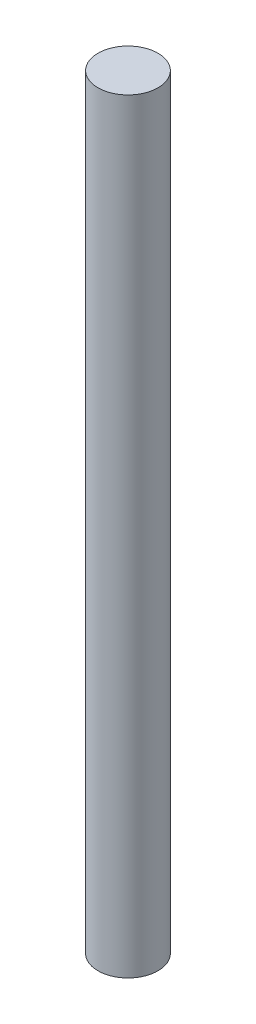
from build123d import *

# Parameters (mm, degrees)
SKETCH1_R           = 4
BOSS_EXTRUDE1_DEPTH = 102


with BuildPart() as part:
    # Sketch1 → Boss-Extrude1 (new body)
    with BuildSketch(Plane(origin=(0, 0, 0), x_dir=(1, 0, 0), z_dir=(0, 1, 0))):
        Circle(SKETCH1_R)
    extrude(amount=BOSS_EXTRUDE1_DEPTH)


solid = part.part
